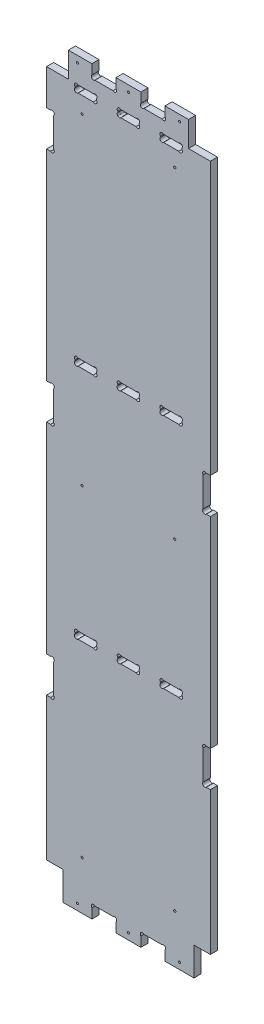
from build123d import *

# Parameters (mm, degrees)
BOSS_EXTRUDE1_DEPTH                            = 10
SKETCH2_W                                      = 33.8
SKETCH2_H                                      = 18
CUT_EXTRUDE1_DEPTH                             = 38
CAVITY1_START                                  = -10
CAVITY1_OUTLINE_W                              = 23
CAVITY1_OUTLINE_H                              = 40.02
CAVITY1_OUTLINE_R                              = 1.5
CAVITY1_DEPTH                                  = 10
ASSEM8_TALL_DRAWER_422_30_955_1_TALL_DRA_START = -10
ASSEM8_TALL_DRAWER_422_30_955_1_TALL_2_R       = 1.5
ASSEM8_TALL_DRAWER_422_30_955_1_TALL_DRA_DEPTH = 10
F_3_0_3_DIAMETER_HOLE1_D                       = 3
F_3_0_3_DIAMETER_HOLE1_DEPTH                   = 15
F_3_0_3_DIAMETER_HOLE1_TIP                     = 0.901290929
SKETCH6_R                                      = 3
CUT_EXTRUDE3_DEPTH                             = 10


# Read off the part's stored shape, not the designer's step: Cavity1, Assem8^tall_drawer_422_30_955<1>@tall_drawer_422_30_955/drawer_module<2>@Assem8^tall_drawer_422_30_955/Part14^drawer_module<1>@drawer_module1
with BuildPart() as part:
    # Sketch1 → Boss-Extrude1 (new body)
    with BuildSketch(Plane.XY):
        Polygon((18, -35.36), (-12.7, -35.36), (-12.7, 0), (-181.3, 0), (-181.3, -35.36), (-212, -35.36), (-212, -1039.94), (18, -1039.94), align=None)
    extrude(amount=-BOSS_EXTRUDE1_DEPTH)

    # Sketch2 → Cut-Extrude1 (cut)
    with BuildSketch(Plane.XY):
        with Locations((-62.6, -9)):
            Rectangle(SKETCH2_W, SKETCH2_H)
        with Locations((-131.4, -9)):
            Rectangle(SKETCH2_W, SKETCH2_H)
        with Locations((-131.4, -1030.94)):
            Rectangle(SKETCH2_W, SKETCH2_H)
        with Locations((-62.6, -1030.94)):
            Rectangle(SKETCH2_W, SKETCH2_H)
    extrude(amount=-CUT_EXTRUDE1_DEPTH, mode=Mode.SUBTRACT)

    # Cavity1 outline → Cavity1 (cut)
    with BuildSketch(Plane.XY.offset(CAVITY1_START)):
        with BuildLine():
            Line((-112, -39.667990414), (-112, -41.252009586))
            ThreePointArc((-112, -41.252009586), (-112.844586347, -43.338679656), (-112, -45.425349727))
            Line((-112, -45.425349727), (-112, -45.46))
            Line((-112, -45.46), (-111.96590669, -45.46))
            ThreePointArc((-111.96590669, -45.46), (-109.844586347, -46.338679656), (-107.723266003, -45.46))
            Line((-107.723266003, -45.46), (-86.242640687, -45.46))
            ThreePointArc((-86.242640687, -45.46), (-82, -45.46), (-82, -41.217359313))
            Line((-82, -41.217359313), (-82, -39.702640687))
            ThreePointArc((-82, -39.702640687), (-82, -35.46), (-86.242640687, -35.46))
            Line((-86.242640687, -35.46), (-107.723266003, -35.46))
            ThreePointArc((-107.723266003, -35.46), (-109.844586347, -34.581320344), (-111.96590669, -35.46))
            Line((-111.96590669, -35.46), (-112, -35.46))
            Line((-112, -35.46), (-112, -35.494650273))
            ThreePointArc((-112, -35.494650273), (-112.844586347, -37.581320344), (-112, -39.667990414))
        make_face()
        with BuildLine():
            Line((-112, -703.702640687), (-112, -705.217359313))
            ThreePointArc((-112, -705.217359313), (-112, -709.46), (-107.757359313, -709.46))
            Line((-107.757359313, -709.46), (-86.242640687, -709.46))
            ThreePointArc((-86.242640687, -709.46), (-82, -709.46), (-82, -705.217359313))
            Line((-82, -705.217359313), (-82, -703.708562016))
            ThreePointArc((-82, -703.708562016), (-81.121320344, -701.587241672), (-82, -699.465921329))
            Line((-82, -699.465921329), (-82, -699.46))
            Line((-82, -699.46), (-82.005937904, -699.46))
            ThreePointArc((-82.005937904, -699.46), (-84.121320344, -698.587241672), (-86.236702783, -699.46))
            Line((-86.236702783, -699.46), (-107.757359313, -699.46))
            ThreePointArc((-107.757359313, -699.46), (-112, -699.46), (-112, -703.702640687))
        make_face()
        with BuildLine():
            Line((-112, -371.702640687), (-112, -373.217359313))
            ThreePointArc((-112, -373.217359313), (-112, -377.46), (-107.757359313, -377.46))
            Line((-107.757359313, -377.46), (-86.242640687, -377.46))
            ThreePointArc((-86.242640687, -377.46), (-82, -377.46), (-82, -373.217359313))
            Line((-82, -373.217359313), (-82, -371.702640687))
            ThreePointArc((-82, -371.702640687), (-82, -367.46), (-86.242640687, -367.46))
            Line((-86.242640687, -367.46), (-107.757359313, -367.46))
            ThreePointArc((-107.757359313, -367.46), (-112, -367.46), (-112, -371.702640687))
        make_face()
        with BuildLine():
            Line((-22, -35.46), (-22.110875161, -35.46))
            ThreePointArc((-22.110875161, -35.46), (-24.232195505, -34.581320344), (-26.353515848, -35.46))
            Line((-26.353515848, -35.46), (-47.757359313, -35.46))
            ThreePointArc((-47.757359313, -35.46), (-52, -35.46), (-52, -39.702640687))
            Line((-52, -39.702640687), (-52, -41.217359313))
            ThreePointArc((-52, -41.217359313), (-52, -45.46), (-47.757359313, -45.46))
            Line((-47.757359313, -45.46), (-26.242640687, -45.46))
            ThreePointArc((-26.242640687, -45.46), (-22, -45.46), (-22, -41.217359313))
            Line((-22, -41.217359313), (-22, -39.585641483))
            ThreePointArc((-22, -39.585641483), (-21.232195504, -37.581320344), (-22, -35.576999204))
            Line((-22, -35.576999204), (-22, -35.46))
        make_face()
        with BuildLine():
            Line((-146.242640687, -35.46), (-167.757359313, -35.46))
            ThreePointArc((-167.757359313, -35.46), (-172, -35.46), (-172, -39.702640687))
            Line((-172, -39.702640687), (-172, -41.217359313))
            ThreePointArc((-172, -41.217359313), (-172, -45.46), (-167.757359313, -45.46))
            Line((-167.757359313, -45.46), (-146.242640687, -45.46))
            ThreePointArc((-146.242640687, -45.46), (-142, -45.46), (-142, -41.217359313))
            Line((-142, -41.217359313), (-142, -39.702640687))
            ThreePointArc((-142, -39.702640687), (-142, -35.46), (-146.242640687, -35.46))
        make_face()
        with BuildLine():
            Line((-22, -705.223280642), (-22, -703.714483345))
            ThreePointArc((-22, -703.714483345), (-21.121320344, -701.593163001), (-22, -699.471842658))
            Line((-22, -699.471842658), (-22, -699.46))
            Line((-22, -699.46), (-22.011909144, -699.46))
            ThreePointArc((-22.011909144, -699.46), (-24.121320343, -698.593163001), (-26.230731543, -699.46))
            Line((-26.230731543, -699.46), (-47.763297217, -699.46))
            ThreePointArc((-47.763297217, -699.46), (-49.878679656, -698.587241672), (-51.994062096, -699.46))
            Line((-51.994062096, -699.46), (-52, -699.46))
            Line((-52, -699.46), (-52, -699.465921329))
            ThreePointArc((-52, -699.465921329), (-52.878679656, -701.587241672), (-52, -703.708562016))
            Line((-52, -703.708562016), (-52, -705.223280642))
            ThreePointArc((-52, -705.223280642), (-51.997041393, -709.468875815), (-47.751454467, -709.46))
            Line((-47.751454467, -709.46), (-26.248545533, -709.46))
            ThreePointArc((-26.248545533, -709.46), (-22.002958607, -709.468875815), (-22, -705.223280642))
        make_face()
        with BuildLine():
            Line((-22, -373.217359313), (-22, -371.585641483))
            ThreePointArc((-22, -371.585641483), (-21.232195504, -369.581320344), (-22, -367.576999204))
            Line((-22, -367.576999204), (-22, -367.46))
            Line((-22, -367.46), (-22.110875161, -367.46))
            ThreePointArc((-22.110875161, -367.46), (-24.232195505, -366.581320344), (-26.353515848, -367.46))
            Line((-26.353515848, -367.46), (-47.757359313, -367.46))
            ThreePointArc((-47.757359313, -367.46), (-52, -367.46), (-52, -371.702640687))
            Line((-52, -371.702640687), (-52, -373.217359313))
            ThreePointArc((-52, -373.217359313), (-52, -377.46), (-47.757359313, -377.46))
            Line((-47.757359313, -377.46), (-26.242640687, -377.46))
            ThreePointArc((-26.242640687, -377.46), (-22, -377.46), (-22, -373.217359313))
        make_face()
        with BuildLine():
            Line((-142, -699.46), (-142.005937904, -699.46))
            ThreePointArc((-142.005937904, -699.46), (-144.121320344, -698.587241672), (-146.236702783, -699.46))
            Line((-146.236702783, -699.46), (-167.757359313, -699.46))
            ThreePointArc((-167.757359313, -699.46), (-172, -699.46), (-172, -703.702640687))
            Line((-172, -703.702640687), (-172, -705.217359313))
            ThreePointArc((-172, -705.217359313), (-172, -709.46), (-167.757359313, -709.46))
            Line((-167.757359313, -709.46), (-146.242640687, -709.46))
            ThreePointArc((-146.242640687, -709.46), (-142, -709.46), (-142, -705.217359313))
            Line((-142, -705.217359313), (-142, -703.708562016))
            ThreePointArc((-142, -703.708562016), (-141.121320344, -701.587241672), (-142, -699.465921329))
            Line((-142, -699.465921329), (-142, -699.46))
        make_face()
        with BuildLine():
            Line((-142, -373.217359313), (-142, -371.702640687))
            ThreePointArc((-142, -371.702640687), (-142, -367.46), (-146.242640687, -367.46))
            Line((-146.242640687, -367.46), (-167.757359313, -367.46))
            ThreePointArc((-167.757359313, -367.46), (-172, -367.46), (-172, -371.702640687))
            Line((-172, -371.702640687), (-172, -373.217359313))
            ThreePointArc((-172, -373.217359313), (-172, -377.46), (-167.757359313, -377.46))
            Line((-167.757359313, -377.46), (-146.242640687, -377.46))
            ThreePointArc((-146.242640687, -377.46), (-142, -377.46), (-142, -373.217359313))
        make_face()
        with BuildLine():
            Line((12.242640687, -467.46), (18, -467.46))
            Line((18, -467.46), (18, -417.46))
            Line((18, -417.46), (12.242640687, -417.46))
            ThreePointArc((12.242640687, -417.46), (8, -417.46), (8, -421.702640687))
            Line((8, -421.702640687), (8, -463.217359313))
            ThreePointArc((8, -463.217359313), (8, -467.46), (12.242640687, -467.46))
        make_face()
        with BuildLine():
            Line((12.242640687, -799.46), (18, -799.46))
            Line((18, -799.46), (18, -749.46))
            Line((18, -749.46), (12.242640687, -749.46))
            ThreePointArc((12.242640687, -749.46), (8, -749.46), (8, -753.702640687))
            Line((8, -753.702640687), (8, -795.217359313))
            ThreePointArc((8, -795.217359313), (8, -799.46), (12.242640687, -799.46))
        make_face()
        with Locations((6.5, -1019.93)):
            Rectangle(CAVITY1_OUTLINE_W, CAVITY1_OUTLINE_H)
        with BuildLine():
            ThreePointArc((-45.7, -1026.182640687), (-44.821320344, -1024.061320344), (-45.7, -1021.94))
            Line((-45.7, -1021.94), (-45.7, -1026.182640687))
        make_face()
        with BuildLine():
            ThreePointArc((-45.7, -1021.94), (-47.821320344, -1021.061320344), (-49.942640687, -1021.94))
            Line((-49.942640687, -1021.94), (-45.7, -1021.94))
        make_face()
        with BuildLine():
            ThreePointArc((-75.257359313, -1021.94), (-77.378679656, -1021.061320344), (-79.5, -1021.94))
            Line((-79.5, -1021.94), (-75.257359313, -1021.94))
        make_face()
        with BuildLine():
            ThreePointArc((-79.5, -1021.94), (-80.378679656, -1024.061320344), (-79.5, -1026.182640687))
            Line((-79.5, -1026.182640687), (-79.5, -1021.94))
        make_face()
        with BuildLine():
            ThreePointArc((-114.5, -1026.182640687), (-113.621320344, -1024.061320344), (-114.5, -1021.94))
            Line((-114.5, -1021.94), (-114.5, -1026.182640687))
        make_face()
        with BuildLine():
            ThreePointArc((-114.5, -1021.94), (-116.621320344, -1021.061320344), (-118.742640687, -1021.94))
            Line((-118.742640687, -1021.94), (-114.5, -1021.94))
        make_face()
        with BuildLine():
            ThreePointArc((-144.057359313, -1021.94), (-146.178679657, -1021.061320344), (-148.3, -1021.94))
            Line((-148.3, -1021.94), (-144.057359313, -1021.94))
        make_face()
        with BuildLine():
            ThreePointArc((-148.3, -1021.94), (-149.178679656, -1024.061320344), (-148.3, -1026.182640687))
            Line((-148.3, -1026.182640687), (-148.3, -1021.94))
        make_face()
        with Locations((-200.5, -1019.93)):
            Rectangle(CAVITY1_OUTLINE_W, CAVITY1_OUTLINE_H)
        with BuildLine():
            Line((-206.242640687, -749.46), (-212, -749.46))
            Line((-212, -749.46), (-212, -799.46))
            Line((-212, -799.46), (-206.242640687, -799.46))
            ThreePointArc((-206.242640687, -799.46), (-202, -799.46), (-202, -795.217359313))
            Line((-202, -795.217359313), (-202, -753.702640687))
            ThreePointArc((-202, -753.702640687), (-202, -749.46), (-206.242640687, -749.46))
        make_face()
        with BuildLine():
            Line((-212, -85.46), (-212, -135.46))
            Line((-212, -135.46), (-206.242640687, -135.46))
            ThreePointArc((-206.242640687, -135.46), (-202, -135.46), (-202, -131.217359313))
            Line((-202, -131.217359313), (-202, -89.702640687))
            ThreePointArc((-202, -89.702640687), (-202, -85.46), (-206.242640687, -85.46))
            Line((-206.242640687, -85.46), (-212, -85.46))
        make_face()
        with BuildLine():
            Line((-202, -417.46), (-202.022665876, -417.46))
            ThreePointArc((-202.022665876, -417.46), (-204.121320344, -416.603746587), (-206.219974811, -417.46))
            Line((-206.219974811, -417.46), (-212, -417.46))
            Line((-212, -417.46), (-212, -467.46))
            Line((-212, -467.46), (-206.242640687, -467.46))
            ThreePointArc((-206.242640687, -467.46), (-202, -467.46), (-202, -463.217359313))
            Line((-202, -463.217359313), (-202, -421.72506693))
            ThreePointArc((-202, -421.72506693), (-201.121320344, -419.603746587), (-202, -417.482426243))
            Line((-202, -417.482426243), (-202, -417.46))
        make_face()
        with Locations((-97, -9)):
            Circle(CAVITY1_OUTLINE_R)
        with Locations((-168.65, -9)):
            Circle(CAVITY1_OUTLINE_R)
        with Locations((-25.35, -9)):
            Circle(CAVITY1_OUTLINE_R)
        with Locations((-25.35, -1030.94)):
            Circle(CAVITY1_OUTLINE_R)
        with Locations((-168.65, -1030.94)):
            Circle(CAVITY1_OUTLINE_R)
        with Locations((-97, -1030.94)):
            Circle(CAVITY1_OUTLINE_R)
        with Locations((-162, -519.97)):
            Circle(CAVITY1_OUTLINE_R)
        with Locations((-32, -519.97)):
            Circle(CAVITY1_OUTLINE_R)
        with Locations((-32, -971.94)):
            Circle(CAVITY1_OUTLINE_R)
        with Locations((-162, -68)):
            Circle(CAVITY1_OUTLINE_R)
        with Locations((-32, -68)):
            Circle(CAVITY1_OUTLINE_R)
        with Locations((-162, -971.94)):
            Circle(CAVITY1_OUTLINE_R)
        with BuildLine():
            Line((-148.3, -18), (-148.3, -13.757359313))
            ThreePointArc((-148.3, -13.757359313), (-149.178679656, -15.878679657), (-148.3, -18))
        make_face()
        with BuildLine():
            Line((-114.5, -13.757359313), (-114.5, -18))
            ThreePointArc((-114.5, -18), (-113.621320344, -15.878679657), (-114.5, -13.757359313))
        make_face()
        with BuildLine():
            Line((-114.5, -18), (-118.742640687, -18))
            ThreePointArc((-118.742640687, -18), (-116.621320344, -18.878679656), (-114.5, -18))
        make_face()
        with BuildLine():
            Line((-144.057359313, -18), (-148.3, -18))
            ThreePointArc((-148.3, -18), (-146.178679657, -18.878679656), (-144.057359313, -18))
        make_face()
        with BuildLine():
            Line((-79.5, -18), (-79.5, -13.757359313))
            ThreePointArc((-79.5, -13.757359313), (-80.378679656, -15.878679657), (-79.5, -18))
        make_face()
        with BuildLine():
            Line((-45.7, -13.757359313), (-45.7, -18))
            ThreePointArc((-45.7, -18), (-44.821320344, -15.878679657), (-45.7, -13.757359313))
        make_face()
        with BuildLine():
            Line((-45.7, -18), (-49.942640687, -18))
            ThreePointArc((-49.942640687, -18), (-47.821320344, -18.878679656), (-45.7, -18))
        make_face()
        with BuildLine():
            Line((-75.257359313, -18), (-79.5, -18))
            ThreePointArc((-79.5, -18), (-77.378679656, -18.878679656), (-75.257359313, -18))
        make_face()
    extrude(amount=CAVITY1_DEPTH, mode=Mode.SUBTRACT)

    # Assem8_tall_drawer_422_30_955_1_tall 2 → Assem8^tall_drawer_422_30_955<1>@tall_drawer_422_30_955/drawer_module<2>@Assem8^tall_drawer_422_30_955/Part14^drawer_module<1>@drawer_module1 (add)
    with BuildSketch(Plane.XY.offset(ASSEM8_TALL_DRAWER_422_30_955_1_TALL_DRA_START)):
        with BuildLine():
            ThreePointArc((-49.942640687, -18), (-47.821320344, -18.878679656), (-45.7, -18))
            Line((-45.7, -18), (-49.942640687, -18))
        make_face()
        with BuildLine():
            ThreePointArc((-79.5, -13.757359313), (-80.378679656, -15.878679657), (-79.5, -18))
            Line((-79.5, -18), (-79.5, -13.757359313))
        make_face()
        with BuildLine():
            ThreePointArc((-79.5, -18), (-77.378679656, -18.878679656), (-75.257359313, -18))
            Line((-75.257359313, -18), (-79.5, -18))
        make_face()
        with BuildLine():
            Line((-45.7, -13.757359313), (-45.7, -18))
            ThreePointArc((-45.7, -18), (-44.821320344, -15.878679657), (-45.7, -13.757359313))
        make_face()
        with BuildLine():
            Line((-79.5, -1026.182640687), (-79.5, -1021.94))
            ThreePointArc((-79.5, -1021.94), (-80.378679656, -1024.061320344), (-79.5, -1026.182640687))
        make_face()
        with BuildLine():
            Line((-79.5, -1021.94), (-75.257359313, -1021.94))
            ThreePointArc((-75.257359313, -1021.94), (-77.378679656, -1021.061320344), (-79.5, -1021.94))
        make_face()
        with BuildLine():
            Line((-49.942640687, -1021.94), (-45.7, -1021.94))
            ThreePointArc((-45.7, -1021.94), (-47.821320344, -1021.061320344), (-49.942640687, -1021.94))
        make_face()
        with BuildLine():
            Line((-45.7, -1021.94), (-45.7, -1026.182640687))
            ThreePointArc((-45.7, -1026.182640687), (-44.821320344, -1024.061320344), (-45.7, -1021.94))
        make_face()
        with BuildLine():
            Line((-114.5, -13.757359313), (-114.5, -18))
            ThreePointArc((-114.5, -18), (-113.621320344, -15.878679657), (-114.5, -13.757359313))
        make_face()
        with BuildLine():
            Line((-114.5, -18), (-118.742640687, -18))
            ThreePointArc((-118.742640687, -18), (-116.621320344, -18.878679656), (-114.5, -18))
        make_face()
        with BuildLine():
            ThreePointArc((-148.3, -13.757359313), (-149.178679656, -15.878679657), (-148.3, -18))
            Line((-148.3, -18), (-148.3, -13.757359313))
        make_face()
        with BuildLine():
            Line((-144.057359313, -18), (-148.3, -18))
            ThreePointArc((-148.3, -18), (-146.178679657, -18.878679656), (-144.057359313, -18))
        make_face()
        with BuildLine():
            Line((-148.3, -1026.182640687), (-148.3, -1021.94))
            ThreePointArc((-148.3, -1021.94), (-149.178679656, -1024.061320344), (-148.3, -1026.182640687))
        make_face()
        with BuildLine():
            Line((-148.3, -1021.94), (-144.057359313, -1021.94))
            ThreePointArc((-144.057359313, -1021.94), (-146.178679657, -1021.061320344), (-148.3, -1021.94))
        make_face()
        with BuildLine():
            Line((-118.742640687, -1021.94), (-114.5, -1021.94))
            ThreePointArc((-114.5, -1021.94), (-116.621320344, -1021.061320344), (-118.742640687, -1021.94))
        make_face()
        with BuildLine():
            Line((-114.5, -1021.94), (-114.5, -1026.182640687))
            ThreePointArc((-114.5, -1026.182640687), (-113.621320344, -1024.061320344), (-114.5, -1021.94))
        make_face()
        with BuildLine():
            ThreePointArc((-172, -41.217359313), (-172.878679656, -43.338679657), (-172, -45.46))
            Line((-172, -45.46), (-172, -41.217359313))
        make_face()
        with BuildLine():
            Line((-167.757359313, -45.46), (-172, -45.46))
            ThreePointArc((-172, -45.46), (-169.878679656, -46.338679656), (-167.757359313, -45.46))
        make_face()
        with BuildLine():
            ThreePointArc((-172, -35.46), (-172.878679656, -37.581320343), (-172, -39.702640687))
            Line((-172, -39.702640687), (-172, -35.46))
        make_face()
        with BuildLine():
            Line((-142, -45.46), (-146.242640687, -45.46))
            ThreePointArc((-146.242640687, -45.46), (-144.121320344, -46.338679656), (-142, -45.46))
        make_face()
        with BuildLine():
            ThreePointArc((-167.757359313, -35.46), (-169.878679656, -34.581320344), (-172, -35.46))
            Line((-172, -35.46), (-167.757359313, -35.46))
        make_face()
        with BuildLine():
            Line((-142, -41.217359313), (-142, -45.46))
            ThreePointArc((-142, -45.46), (-141.121320344, -43.338679657), (-142, -41.217359313))
        make_face()
        with BuildLine():
            ThreePointArc((-142, -35.46), (-144.121320344, -34.581320344), (-146.242640687, -35.46))
            Line((-146.242640687, -35.46), (-142, -35.46))
        make_face()
        with BuildLine():
            Line((-142, -35.46), (-142, -39.702640687))
            ThreePointArc((-142, -39.702640687), (-141.121320344, -37.581320343), (-142, -35.46))
        make_face()
        with BuildLine():
            ThreePointArc((-172, -705.217359313), (-172.878679656, -707.338679657), (-172, -709.46))
            Line((-172, -709.46), (-172, -705.217359313))
        make_face()
        with BuildLine():
            Line((-167.757359313, -709.46), (-172, -709.46))
            ThreePointArc((-172, -709.46), (-169.878679656, -710.338679656), (-167.757359313, -709.46))
        make_face()
        with BuildLine():
            ThreePointArc((-172, -699.46), (-172.878679656, -701.581320344), (-172, -703.702640687))
            Line((-172, -703.702640687), (-172, -699.46))
        make_face()
        with BuildLine():
            Line((-142, -709.46), (-146.242640687, -709.46))
            ThreePointArc((-146.242640687, -709.46), (-144.121320344, -710.338679656), (-142, -709.46))
        make_face()
        with BuildLine():
            ThreePointArc((-167.757359313, -699.46), (-169.878679656, -698.581320344), (-172, -699.46))
            Line((-172, -699.46), (-167.757359313, -699.46))
        make_face()
        with BuildLine():
            Line((-142, -705.217359313), (-142, -709.46))
            ThreePointArc((-142, -709.46), (-141.121320344, -707.338679657), (-142, -705.217359313))
        make_face()
        with BuildLine():
            ThreePointArc((-142.005937904, -699.46), (-144.121320344, -698.587241672), (-146.236702783, -699.46))
            Line((-146.236702783, -699.46), (-142.005937904, -699.46))
        make_face()
        with BuildLine():
            Line((-142, -699.465921329), (-142, -703.708562016))
            ThreePointArc((-142, -703.708562016), (-141.121320344, -701.587241672), (-142, -699.465921329))
        make_face()
        with BuildLine():
            ThreePointArc((-172, -373.217359313), (-172.878679656, -375.338679656), (-172, -377.46))
            Line((-172, -377.46), (-172, -373.217359313))
        make_face()
        with BuildLine():
            Line((-167.757359313, -377.46), (-172, -377.46))
            ThreePointArc((-172, -377.46), (-169.878679656, -378.338679656), (-167.757359313, -377.46))
        make_face()
        with BuildLine():
            ThreePointArc((-172, -367.46), (-172.878679656, -369.581320344), (-172, -371.702640687))
            Line((-172, -371.702640687), (-172, -367.46))
        make_face()
        with BuildLine():
            Line((-142, -377.46), (-146.242640687, -377.46))
            ThreePointArc((-146.242640687, -377.46), (-144.121320344, -378.338679656), (-142, -377.46))
        make_face()
        with BuildLine():
            ThreePointArc((-167.757359313, -367.46), (-169.878679656, -366.581320344), (-172, -367.46))
            Line((-172, -367.46), (-167.757359313, -367.46))
        make_face()
        with BuildLine():
            Line((-142, -373.217359313), (-142, -377.46))
            ThreePointArc((-142, -377.46), (-141.121320344, -375.338679656), (-142, -373.217359313))
        make_face()
        with BuildLine():
            ThreePointArc((-142, -367.46), (-144.121320344, -366.581320344), (-146.242640687, -367.46))
            Line((-146.242640687, -367.46), (-142, -367.46))
        make_face()
        with BuildLine():
            Line((-142, -367.46), (-142, -371.702640687))
            ThreePointArc((-142, -371.702640687), (-141.121320344, -369.581320344), (-142, -367.46))
        make_face()
        with BuildLine():
            ThreePointArc((-107.723266003, -35.46), (-109.844586347, -34.581320344), (-111.96590669, -35.46))
            Line((-111.96590669, -35.46), (-107.723266003, -35.46))
        make_face()
        with BuildLine():
            Line((-112, -39.667990414), (-112, -35.494650273))
            ThreePointArc((-112, -35.494650273), (-112.844586347, -37.581320344), (-112, -39.667990414))
        make_face()
        with BuildLine():
            ThreePointArc((-82, -35.46), (-84.121320344, -34.581320344), (-86.242640687, -35.46))
            Line((-86.242640687, -35.46), (-82, -35.46))
        make_face()
        with BuildLine():
            Line((-112, -45.425349727), (-112, -41.252009586))
            ThreePointArc((-112, -41.252009586), (-112.844586347, -43.338679656), (-112, -45.425349727))
        make_face()
        with BuildLine():
            ThreePointArc((-82, -39.702640687), (-81.121320344, -37.581320343), (-82, -35.46))
            Line((-82, -35.46), (-82, -39.702640687))
        make_face()
        with BuildLine():
            ThreePointArc((-82, -45.46), (-81.121320344, -43.338679657), (-82, -41.217359313))
            Line((-82, -41.217359313), (-82, -45.46))
        make_face()
        with BuildLine():
            Line((-107.723266003, -45.46), (-111.96590669, -45.46))
            ThreePointArc((-111.96590669, -45.46), (-109.844586347, -46.338679656), (-107.723266003, -45.46))
        make_face()
        with BuildLine():
            ThreePointArc((-86.242640687, -45.46), (-84.121320344, -46.338679656), (-82, -45.46))
            Line((-82, -45.46), (-86.242640687, -45.46))
        make_face()
        with BuildLine():
            ThreePointArc((-47.757359313, -35.46), (-49.878679656, -34.581320344), (-52, -35.46))
            Line((-52, -35.46), (-47.757359313, -35.46))
        make_face()
        with BuildLine():
            Line((-52, -39.702640687), (-52, -35.46))
            ThreePointArc((-52, -35.46), (-52.878679656, -37.581320343), (-52, -39.702640687))
        make_face()
        with BuildLine():
            ThreePointArc((-22.110875161, -35.46), (-24.232195505, -34.581320344), (-26.353515848, -35.46))
            Line((-26.353515848, -35.46), (-22.110875161, -35.46))
        make_face()
        with BuildLine():
            Line((-52, -45.46), (-52, -41.217359313))
            ThreePointArc((-52, -41.217359313), (-52.878679656, -43.338679657), (-52, -45.46))
        make_face()
        with BuildLine():
            Line((-47.757359313, -45.46), (-52, -45.46))
            ThreePointArc((-52, -45.46), (-49.878679656, -46.338679656), (-47.757359313, -45.46))
        make_face()
        with BuildLine():
            ThreePointArc((-22, -39.585641483), (-21.232195504, -37.581320344), (-22, -35.576999204))
            Line((-22, -35.576999204), (-22, -39.585641483))
        make_face()
        with BuildLine():
            Line((-22, -45.46), (-26.242640687, -45.46))
            ThreePointArc((-26.242640687, -45.46), (-24.121320344, -46.338679656), (-22, -45.46))
        make_face()
        with BuildLine():
            Line((-22, -41.217359313), (-22, -45.46))
            ThreePointArc((-22, -45.46), (-21.121320344, -43.338679657), (-22, -41.217359313))
        make_face()
        with BuildLine():
            ThreePointArc((-112, -705.217359313), (-112.878679656, -707.338679657), (-112, -709.46))
            Line((-112, -709.46), (-112, -705.217359313))
        make_face()
        with BuildLine():
            Line((-107.757359313, -709.46), (-112, -709.46))
            ThreePointArc((-112, -709.46), (-109.878679656, -710.338679656), (-107.757359313, -709.46))
        make_face()
        with BuildLine():
            ThreePointArc((-112, -699.46), (-112.878679656, -701.581320344), (-112, -703.702640687))
            Line((-112, -703.702640687), (-112, -699.46))
        make_face()
        with BuildLine():
            Line((-82, -709.46), (-86.242640687, -709.46))
            ThreePointArc((-86.242640687, -709.46), (-84.121320344, -710.338679656), (-82, -709.46))
        make_face()
        with BuildLine():
            ThreePointArc((-107.757359313, -699.46), (-109.878679656, -698.581320344), (-112, -699.46))
            Line((-112, -699.46), (-107.757359313, -699.46))
        make_face()
        with BuildLine():
            Line((-82, -705.217359313), (-82, -709.46))
            ThreePointArc((-82, -709.46), (-81.121320344, -707.338679657), (-82, -705.217359313))
        make_face()
        with BuildLine():
            ThreePointArc((-82.005937904, -699.46), (-84.121320344, -698.587241672), (-86.236702783, -699.46))
            Line((-86.236702783, -699.46), (-82.005937904, -699.46))
        make_face()
        with BuildLine():
            Line((-82, -699.465921329), (-82, -703.708562016))
            ThreePointArc((-82, -703.708562016), (-81.121320344, -701.587241672), (-82, -699.465921329))
        make_face()
        with BuildLine():
            ThreePointArc((-112, -373.217359313), (-112.878679656, -375.338679656), (-112, -377.46))
            Line((-112, -377.46), (-112, -373.217359313))
        make_face()
        with BuildLine():
            Line((-107.757359313, -377.46), (-112, -377.46))
            ThreePointArc((-112, -377.46), (-109.878679656, -378.338679656), (-107.757359313, -377.46))
        make_face()
        with BuildLine():
            ThreePointArc((-112, -367.46), (-112.878679656, -369.581320344), (-112, -371.702640687))
            Line((-112, -371.702640687), (-112, -367.46))
        make_face()
        with BuildLine():
            Line((-82, -377.46), (-86.242640687, -377.46))
            ThreePointArc((-86.242640687, -377.46), (-84.121320344, -378.338679656), (-82, -377.46))
        make_face()
        with BuildLine():
            ThreePointArc((-107.757359313, -367.46), (-109.878679656, -366.581320344), (-112, -367.46))
            Line((-112, -367.46), (-107.757359313, -367.46))
        make_face()
        with BuildLine():
            Line((-82, -373.217359313), (-82, -377.46))
            ThreePointArc((-82, -377.46), (-81.121320344, -375.338679656), (-82, -373.217359313))
        make_face()
        with BuildLine():
            ThreePointArc((-82, -367.46), (-84.121320344, -366.581320344), (-86.242640687, -367.46))
            Line((-86.242640687, -367.46), (-82, -367.46))
        make_face()
        with BuildLine():
            Line((-82, -367.46), (-82, -371.702640687))
            ThreePointArc((-82, -371.702640687), (-81.121320344, -369.581320344), (-82, -367.46))
        make_face()
        with BuildLine():
            ThreePointArc((-22, -703.714483345), (-21.121320344, -701.593163001), (-22, -699.471842658))
            Line((-22, -699.471842658), (-22, -703.714483345))
        make_face()
        with BuildLine():
            Line((-26.230731543, -699.46), (-22.011909144, -699.46))
            ThreePointArc((-22.011909144, -699.46), (-24.121320343, -698.593163001), (-26.230731543, -699.46))
        make_face()
        with BuildLine():
            ThreePointArc((-26.248545533, -709.46), (-22.002958607, -709.468875815), (-22, -705.223280642))
            Line((-22, -705.223280642), (-22, -709.46))
            Line((-22, -709.46), (-26.248545533, -709.46))
        make_face()
        with BuildLine():
            Line((-51.994062096, -699.46), (-47.763297217, -699.46))
            ThreePointArc((-47.763297217, -699.46), (-49.878679656, -698.587241672), (-51.994062096, -699.46))
        make_face()
        with BuildLine():
            ThreePointArc((-52, -705.223280642), (-51.997041393, -709.468875815), (-47.751454467, -709.46))
            Line((-47.751454467, -709.46), (-52, -709.46))
            Line((-52, -709.46), (-52, -705.223280642))
        make_face()
        with BuildLine():
            Line((-52, -703.708562016), (-52, -699.465921329))
            ThreePointArc((-52, -699.465921329), (-52.878679656, -701.587241672), (-52, -703.708562016))
        make_face()
        with BuildLine():
            ThreePointArc((-22, -371.585641483), (-21.232195504, -369.581320344), (-22, -367.576999204))
            Line((-22, -367.576999204), (-22, -371.585641483))
        make_face()
        with BuildLine():
            Line((-26.353515848, -367.46), (-22.110875161, -367.46))
            ThreePointArc((-22.110875161, -367.46), (-24.232195505, -366.581320344), (-26.353515848, -367.46))
        make_face()
        with BuildLine():
            ThreePointArc((-22, -377.46), (-21.121320344, -375.338679656), (-22, -373.217359313))
            Line((-22, -373.217359313), (-22, -377.46))
        make_face()
        with BuildLine():
            Line((-52, -367.46), (-47.757359313, -367.46))
            ThreePointArc((-47.757359313, -367.46), (-49.878679656, -366.581320344), (-52, -367.46))
        make_face()
        with BuildLine():
            ThreePointArc((-26.242640687, -377.46), (-24.121320344, -378.338679656), (-22, -377.46))
            Line((-22, -377.46), (-26.242640687, -377.46))
        make_face()
        with BuildLine():
            Line((-52, -371.702640687), (-52, -367.46))
            ThreePointArc((-52, -367.46), (-52.878679656, -369.581320344), (-52, -371.702640687))
        make_face()
        with BuildLine():
            ThreePointArc((-52, -377.46), (-49.878679656, -378.338679656), (-47.757359313, -377.46))
            Line((-47.757359313, -377.46), (-52, -377.46))
        make_face()
        with BuildLine():
            Line((-52, -377.46), (-52, -373.217359313))
            ThreePointArc((-52, -373.217359313), (-52.878679656, -375.338679656), (-52, -377.46))
        make_face()
        with BuildLine():
            ThreePointArc((-202, -749.46), (-204.121320344, -748.581320344), (-206.242640687, -749.46))
            Line((-206.242640687, -749.46), (-202, -749.46))
        make_face()
        with BuildLine():
            ThreePointArc((-206.242640687, -799.46), (-204.121320344, -800.338679656), (-202, -799.46))
            Line((-202, -799.46), (-206.242640687, -799.46))
        make_face()
        with BuildLine():
            ThreePointArc((-202, -799.46), (-201.121320344, -797.338679657), (-202, -795.217359313))
            Line((-202, -795.217359313), (-202, -799.46))
        make_face()
        with BuildLine():
            ThreePointArc((-202, -753.702640687), (-201.121320344, -751.581320344), (-202, -749.46))
            Line((-202, -749.46), (-202, -753.702640687))
        make_face()
        with BuildLine():
            ThreePointArc((12.242640687, -749.46), (10.121320343, -748.581320344), (8, -749.46))
            Line((8, -749.46), (12.242640687, -749.46))
        make_face()
        with BuildLine():
            Line((8, -753.702640687), (8, -749.46))
            ThreePointArc((8, -749.46), (7.121320344, -751.581320344), (8, -753.702640687))
        make_face()
        with BuildLine():
            Line((12.242640687, -799.46), (8, -799.46))
            ThreePointArc((8, -799.46), (10.121320343, -800.338679656), (12.242640687, -799.46))
        make_face()
        with BuildLine():
            Line((8, -799.46), (8, -795.217359313))
            ThreePointArc((8, -795.217359313), (7.121320344, -797.338679657), (8, -799.46))
        make_face()
        with BuildLine():
            ThreePointArc((-202.022665876, -417.46), (-204.121320344, -416.603746587), (-206.219974811, -417.46))
            Line((-206.219974811, -417.46), (-202.022665876, -417.46))
        make_face()
        with BuildLine():
            ThreePointArc((-206.242640687, -467.46), (-204.121320344, -468.338679656), (-202, -467.46))
            Line((-202, -467.46), (-206.242640687, -467.46))
        make_face()
        with BuildLine():
            ThreePointArc((-202, -467.46), (-201.121320344, -465.338679656), (-202, -463.217359313))
            Line((-202, -463.217359313), (-202, -467.46))
        make_face()
        with BuildLine():
            ThreePointArc((-202, -421.72506693), (-201.121320344, -419.603746587), (-202, -417.482426243))
            Line((-202, -417.482426243), (-202, -421.72506693))
        make_face()
        with BuildLine():
            ThreePointArc((12.242640687, -417.46), (10.121320343, -416.581320344), (8, -417.46))
            Line((8, -417.46), (12.242640687, -417.46))
        make_face()
        with BuildLine():
            Line((8, -421.702640687), (8, -417.46))
            ThreePointArc((8, -417.46), (7.121320344, -419.581320344), (8, -421.702640687))
        make_face()
        with BuildLine():
            Line((12.242640687, -467.46), (8, -467.46))
            ThreePointArc((8, -467.46), (10.121320343, -468.338679656), (12.242640687, -467.46))
        make_face()
        with BuildLine():
            Line((8, -467.46), (8, -463.217359313))
            ThreePointArc((8, -463.217359313), (7.121320344, -465.338679656), (8, -467.46))
        make_face()
        with BuildLine():
            ThreePointArc((-202, -85.46), (-204.121320344, -84.581320344), (-206.242640687, -85.46))
            Line((-206.242640687, -85.46), (-202, -85.46))
        make_face()
        with BuildLine():
            ThreePointArc((-206.242640687, -135.46), (-204.121320344, -136.338679656), (-202, -135.46))
            Line((-202, -135.46), (-206.242640687, -135.46))
        make_face()
        with BuildLine():
            ThreePointArc((-202, -135.46), (-201.121320344, -133.338679657), (-202, -131.217359313))
            Line((-202, -131.217359313), (-202, -135.46))
        make_face()
        with BuildLine():
            ThreePointArc((-202, -89.702640687), (-201.121320344, -87.581320343), (-202, -85.46))
            Line((-202, -85.46), (-202, -89.702640687))
        make_face()
        with Locations((-97, -9)):
            Circle(ASSEM8_TALL_DRAWER_422_30_955_1_TALL_2_R)
        with Locations((-168.65, -9)):
            Circle(ASSEM8_TALL_DRAWER_422_30_955_1_TALL_2_R)
        with Locations((-25.35, -9)):
            Circle(ASSEM8_TALL_DRAWER_422_30_955_1_TALL_2_R)
        with Locations((-25.35, -1030.94)):
            Circle(ASSEM8_TALL_DRAWER_422_30_955_1_TALL_2_R)
        with Locations((-168.65, -1030.94)):
            Circle(ASSEM8_TALL_DRAWER_422_30_955_1_TALL_2_R)
        with Locations((-97, -1030.94)):
            Circle(ASSEM8_TALL_DRAWER_422_30_955_1_TALL_2_R)
        with Locations((-162, -519.97)):
            Circle(ASSEM8_TALL_DRAWER_422_30_955_1_TALL_2_R)
        with Locations((-32, -519.97)):
            Circle(ASSEM8_TALL_DRAWER_422_30_955_1_TALL_2_R)
        with Locations((-32, -971.94)):
            Circle(ASSEM8_TALL_DRAWER_422_30_955_1_TALL_2_R)
        with Locations((-162, -68)):
            Circle(ASSEM8_TALL_DRAWER_422_30_955_1_TALL_2_R)
        with Locations((-32, -68)):
            Circle(ASSEM8_TALL_DRAWER_422_30_955_1_TALL_2_R)
        with Locations((-162, -971.94)):
            Circle(ASSEM8_TALL_DRAWER_422_30_955_1_TALL_2_R)
    extrude(amount=ASSEM8_TALL_DRAWER_422_30_955_1_TALL_DRA_DEPTH)

    # Ø3.0 (3) Diameter Hole1
    with Locations(Plane(origin=(0, 0, -10), x_dir=(-1, 0, 0), z_dir=(0, 0, -1))):
        with Locations((162, -971.94), (32, -68), (162, -68), (32, -971.94), (32, -519.97), (162, -519.97), (97, -1030.94), (168.65, -1030.94), (25.35, -1030.94), (25.35, -9), (168.65, -9), (97, -9)):
            Hole(F_3_0_3_DIAMETER_HOLE1_D / 2, depth=F_3_0_3_DIAMETER_HOLE1_DEPTH)
            with Locations((0, 0, -(F_3_0_3_DIAMETER_HOLE1_DEPTH + F_3_0_3_DIAMETER_HOLE1_TIP / 2))):  # 118° drill point
                Cone(0, F_3_0_3_DIAMETER_HOLE1_D / 2, F_3_0_3_DIAMETER_HOLE1_TIP, mode=Mode.SUBTRACT)

    # Sketch6 → Cut-Extrude3 (cut)
    with BuildSketch(Plane.XY):
        with Locations((-77.378679656, -15.878679656)):
            Circle(SKETCH6_R)
        with Locations((-204.121320344, -133.338679656)):
            Circle(SKETCH6_R)
        with Locations((-146.178679656, -15.878679656)):
            Circle(SKETCH6_R)
        with Locations((10.121320344, -465.338679656)):
            Circle(SKETCH6_R)
        with Locations((10.121320344, -797.338679656)):
            Circle(SKETCH6_R)
        with Locations((-47.821320344, -1024.061320344)):
            Circle(SKETCH6_R)
        with Locations((-116.621320344, -1024.061320344)):
            Circle(SKETCH6_R)
        with Locations((-146.178679656, -1024.061320344)):
            Circle(SKETCH6_R)
        with Locations((-77.378679656, -1024.061320344)):
            Circle(SKETCH6_R)
        with Locations((-204.121320344, -751.581320344)):
            Circle(SKETCH6_R)
        with Locations((-204.121320344, -797.338679656)):
            Circle(SKETCH6_R)
        with Locations((10.121320344, -751.581320344)):
            Circle(SKETCH6_R)
        with Locations((-204.121320344, -465.338679656)):
            Circle(SKETCH6_R)
        with Locations((-204.121320344, -419.603746587)):
            Circle(SKETCH6_R)
        with Locations((10.121320344, -419.581320344)):
            Circle(SKETCH6_R)
        with Locations((-204.121320344, -87.581320344)):
            Circle(SKETCH6_R)
        with Locations((-116.621320344, -15.878679656)):
            Circle(SKETCH6_R)
        with Locations((-47.821320344, -15.878679656)):
            Circle(SKETCH6_R)
        with BuildLine():
            ThreePointArc((-169.034165929, -40.46), (-169.878679656, -34.581320344), (-170.723193384, -40.46))
            ThreePointArc((-170.723193384, -40.46), (-169.878679656, -46.338679656), (-169.034165929, -40.46))
        make_face()
        with BuildLine():
            ThreePointArc((-143.276806616, -40.46), (-144.121320344, -34.581320344), (-144.965834071, -40.46))
            ThreePointArc((-144.965834071, -40.46), (-144.121320344, -46.338679656), (-143.276806616, -40.46))
        make_face()
        with BuildLine():
            ThreePointArc((-109.000072619, -40.46), (-109.844586347, -34.581320344), (-110.689100074, -40.46))
            ThreePointArc((-110.689100074, -40.46), (-109.844586347, -46.338679656), (-109.000072619, -40.46))
        make_face()
        with BuildLine():
            ThreePointArc((-83.276806616, -40.46), (-84.121320344, -34.581320344), (-84.965834071, -40.46))
            ThreePointArc((-84.965834071, -40.46), (-84.121320344, -46.338679656), (-83.276806616, -40.46))
        make_face()
        with BuildLine():
            ThreePointArc((-49.034165929, -40.46), (-49.878679656, -34.581320344), (-50.723193384, -40.46))
            ThreePointArc((-50.723193384, -40.46), (-49.878679656, -46.338679656), (-49.034165929, -40.46))
        make_face()
        with BuildLine():
            ThreePointArc((-23.334221965, -40.443774452), (-24.28995876, -34.581876494), (-25.019293883, -40.476225548))
            ThreePointArc((-25.019293883, -40.476225548), (-24.063557088, -46.338123506), (-23.334221965, -40.443774452))
        make_face()
        with BuildLine():
            ThreePointArc((-23.334221965, -372.443774452), (-24.28995876, -366.581876494), (-25.019293883, -372.476225548))
            ThreePointArc((-25.019293883, -372.476225548), (-24.063557088, -378.338123506), (-23.334221965, -372.443774452))
        make_face()
        with BuildLine():
            ThreePointArc((-49.034165929, -372.46), (-49.878679656, -366.581320344), (-50.723193384, -372.46))
            ThreePointArc((-50.723193384, -372.46), (-49.878679656, -378.338679656), (-49.034165929, -372.46))
        make_face()
        with BuildLine():
            ThreePointArc((-109.034165929, -372.46), (-109.878679656, -366.581320344), (-110.723193384, -372.46))
            ThreePointArc((-110.723193384, -372.46), (-109.878679656, -378.338679656), (-109.034165929, -372.46))
        make_face()
        with BuildLine():
            ThreePointArc((-83.276806616, -372.46), (-84.121320344, -366.581320344), (-84.965834071, -372.46))
            ThreePointArc((-84.965834071, -372.46), (-84.121320344, -378.338679656), (-83.276806616, -372.46))
        make_face()
        with BuildLine():
            ThreePointArc((-143.276806616, -372.46), (-144.121320344, -366.581320344), (-144.965834071, -372.46))
            ThreePointArc((-144.965834071, -372.46), (-144.121320344, -378.338679656), (-143.276806616, -372.46))
        make_face()
        with BuildLine():
            ThreePointArc((-169.034165929, -372.46), (-169.878679656, -366.581320344), (-170.723193384, -372.46))
            ThreePointArc((-170.723193384, -372.46), (-169.878679656, -378.338679656), (-169.034165929, -372.46))
        make_face()
        with BuildLine():
            ThreePointArc((-170.723193384, -704.46), (-169.878679656, -710.338679656), (-169.034165929, -704.46))
            ThreePointArc((-169.034165929, -704.46), (-169.878679656, -698.581320344), (-170.723193384, -704.46))
        make_face()
        with BuildLine():
            ThreePointArc((-143.266779368, -704.462960664), (-144.121320344, -698.587241672), (-144.975861319, -704.462960664))
            ThreePointArc((-144.975861319, -704.462960664), (-144.121320344, -710.338679656), (-143.266779368, -704.462960664))
        make_face()
        with BuildLine():
            ThreePointArc((-110.723193384, -704.46), (-109.878679656, -710.338679656), (-109.034165929, -704.46))
            ThreePointArc((-109.034165929, -704.46), (-109.878679656, -698.581320344), (-110.723193384, -704.46))
        make_face()
        with BuildLine():
            ThreePointArc((-83.266779368, -704.462960664), (-84.121320344, -698.587241672), (-84.975861319, -704.462960664))
            ThreePointArc((-84.975861319, -704.462960664), (-84.121320344, -710.338679656), (-83.266779368, -704.462960664))
        make_face()
        with BuildLine():
            ThreePointArc((-50.723193384, -704.465921329), (-49.878679656, -710.344600985), (-49.034165929, -704.465921329))
            ThreePointArc((-49.034165929, -704.465921329), (-49.878679656, -698.587241672), (-50.723193384, -704.465921329))
        make_face()
        with BuildLine():
            ThreePointArc((-23.266779368, -704.468881993), (-24.121320344, -698.593163001), (-24.975861319, -704.468881993))
            ThreePointArc((-24.975861319, -704.468881993), (-24.121320344, -710.344600985), (-23.266779368, -704.468881993))
        make_face()
    extrude(amount=-CUT_EXTRUDE3_DEPTH, mode=Mode.SUBTRACT)


solid = part.part
